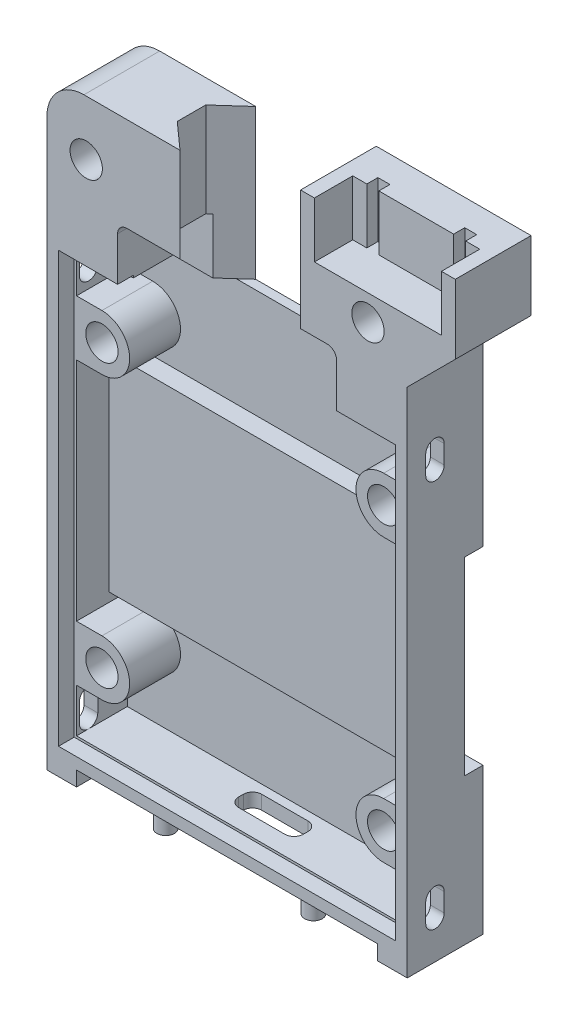
from build123d import *

# Parameters (mm, degrees)
SKETCH1_R              = 1.75
BASE_SHAPE_DEPTH       = 8.2
SKETCH3_W              = 2
SKETCH3_H              = 20.5
STRAP_CUT_DEPTH        = 53.32064602
XT60_CUT_REACH         = 70.811
SKETCH5_R              = 1
POWER_WIRES_CUT_DEPTH  = 53.32064602
SKETCH6_W              = 23.7
SKETCH6_H              = 5
IO_WIRES_CUT_DEPTH     = 6
BOTTOM_DEPTH           = 36
BOTTOM_START           = -1
BOTTOM_HOLES_OUTLINE_R = 1.75
BOTTOM_HOLES_DEPTH     = 1
SKETCH8_W              = 36.5
SKETCH8_H              = 46.5
PCB_CUT_DEPTH          = 1.7
LEDBAR_WIRES_CUT_REACH = 73.411
SKETCH13_W             = 3.2
SKETCH13_H             = 8.2
LEDBAR_SIDES_DEPTH     = 1.6
SKETCH14_R             = 0.95
LEDBAR_MOUNTS_DEPTH    = 2
SKETCH16_W             = 13.75
SKETCH16_H             = 4.15
SKETCH16_W_2           = 1.3
SKETCH16_H_2           = 1.2
BALANCE_PLUG_CUT_DEPTH = 6


with BuildPart() as part:
    # Sketch1 → Base shape (new body)
    with BuildSketch(Plane.XY):
        with BuildLine():
            ThreePointArc((-15.5, 31.1), (-18.328427125, 29.928427125), (-19.5, 27.1))
            Line((-19.5, 27.1), (-19.5, -32.6))
            Line((-19.5, -32.6), (19.5, -32.6))
            Line((19.5, -32.6), (19.5, 21.2))
            Line((19.5, 21.2), (24.7, 26.4))
            Line((24.7, 26.4), (24.7, 33.9))
            Line((24.7, 33.9), (7.95, 33.9))
            Line((7.95, 33.9), (7.95, 31.1))
            Line((7.95, 31.1), (-15.5, 31.1))
        make_face()
        with Locations((-15.25, -23.35)):
            Circle(SKETCH1_R, mode=Mode.SUBTRACT)
        with Locations((15.25, -23.35)):
            Circle(SKETCH1_R, mode=Mode.SUBTRACT)
        with BuildLine():
            Line((-18, -20.35), (-18, 4.15))
            Line((-18, 4.15), (-15.25, 4.15))
            ThreePointArc((-15.25, 4.15), (-12.25, 7.15), (-15.25, 10.15))
            Line((-15.25, 10.15), (-18, 10.15))
            Line((-18, 10.15), (-18, 14.9))
            Line((-18, 14.9), (18, 14.9))
            Line((18, 14.9), (18, 10.15))
            Line((18, 10.15), (15.25, 10.15))
            ThreePointArc((15.25, 10.15), (12.25, 7.15), (15.25, 4.15))
            Line((15.25, 4.15), (18, 4.15))
            Line((18, 4.15), (18, -20.35))
            Line((18, -20.35), (15.25, -20.35))
            ThreePointArc((15.25, -20.35), (12.25, -23.35), (15.25, -26.35))
            Line((15.25, -26.35), (18, -26.35))
            Line((18, -26.35), (18, -31.1))
            Line((18, -31.1), (-18, -31.1))
            Line((-18, -31.1), (-18, -26.35))
            Line((-18, -26.35), (-15.25, -26.35))
            ThreePointArc((-15.25, -26.35), (-12.25, -23.35), (-15.25, -20.35))
            Line((-15.25, -20.35), (-18, -20.35))
        make_face(mode=Mode.SUBTRACT)
        with Locations((-15.25, 7.15)):
            Circle(SKETCH1_R, mode=Mode.SUBTRACT)
        with Locations((-15.25, 25.15)):
            Circle(SKETCH1_R, mode=Mode.SUBTRACT)
        with Locations((15.25, 7.15)):
            Circle(SKETCH1_R, mode=Mode.SUBTRACT)
        with Locations((15.25, 25.15)):
            Circle(SKETCH1_R, mode=Mode.SUBTRACT)
    extrude(amount=BASE_SHAPE_DEPTH)

    # Sketch3 → Strap cut (cut, through all)
    with BuildSketch(Plane(origin=(19.5, 0, 0), x_dir=(0, 0, -1), z_dir=(1, 0, 0))):
        with Locations((-1, -8.1)):
            Rectangle(SKETCH3_W, SKETCH3_H)
    extrude(amount=-STRAP_CUT_DEPTH, mode=Mode.SUBTRACT)

    # Sketch4 → XT60 cut (cut, up to next)
    with BuildSketch(Plane(origin=(0, 31.1, 0), x_dir=(1, 0, 0), z_dir=(0, 1, 0)), mode=Mode.PRIVATE) as xt60_cut_sk1:
        Polygon((7.95, -8.2), (7.95, 0), (-5.099802631, 0), (-7.95, -2.555349365), (-7.95, -5.644650635), (-5.099802631, -8.2), align=None)
    xt60_cut_tool1 = extrude(xt60_cut_sk1.sketch, amount=-XT60_CUT_REACH, mode=Mode.PRIVATE) & part.part
    add(xt60_cut_tool1.solids().sort_by_distance((0.414164, 31.1, 4.1))[0], mode=Mode.SUBTRACT)

    # Sketch5 → Power wires cut (cut, through all)
    with BuildSketch(Plane(origin=(19.5, 0, 0), x_dir=(0, 0, -1), z_dir=(1, 0, 0))):
        with Locations((-5.2, 13.9)):
            Circle(SKETCH5_R)
        with Locations((-5.2, 11.9)):
            Circle(SKETCH5_R)
        with BuildLine():
            ThreePointArc((-5.2, 12.9), (-5.907106781, 13.192893219), (-6.2, 13.9))
            Line((-6.2, 13.9), (-6.2, 11.9))
            ThreePointArc((-6.2, 11.9), (-5.907106781, 12.607106781), (-5.2, 12.9))
        make_face()
        with BuildLine():
            Line((-4.2, 11.9), (-4.2, 13.9))
            ThreePointArc((-4.2, 13.9), (-4.492893219, 13.192893219), (-5.2, 12.9))
            ThreePointArc((-5.2, 12.9), (-4.492893219, 12.607106781), (-4.2, 11.9))
        make_face()
        with Locations((-5.2, -30.1)):
            Circle(SKETCH5_R)
        with Locations((-5.2, -28.1)):
            Circle(SKETCH5_R)
        with BuildLine():
            ThreePointArc((-5.2, -29.1), (-4.492893219, -29.392893219), (-4.2, -30.1))
            Line((-4.2, -30.1), (-4.2, -28.1))
            ThreePointArc((-4.2, -28.1), (-4.492893219, -28.807106781), (-5.2, -29.1))
        make_face()
        with BuildLine():
            Line((-6.2, -28.1), (-6.2, -30.1))
            ThreePointArc((-6.2, -30.1), (-5.907106781, -29.392893219), (-5.2, -29.1))
            ThreePointArc((-5.2, -29.1), (-5.907106781, -28.807106781), (-6.2, -28.1))
        make_face()
    extrude(amount=-POWER_WIRES_CUT_DEPTH, mode=Mode.SUBTRACT)

    # Sketch6 → IO wires cut (cut)
    with BuildSketch(Plane.XY.offset(8.2)):
        with BuildLine():
            ThreePointArc((-10.85, 20.9), (-11.557106781, 20.607106781), (-11.85, 19.9))
            Line((-11.85, 19.9), (11.85, 19.9))
            ThreePointArc((11.85, 19.9), (11.557106781, 20.607106781), (10.85, 20.9))
            Line((10.85, 20.9), (-10.85, 20.9))
        make_face()
        with Locations((0, 17.4)):
            Rectangle(SKETCH6_W, SKETCH6_H)
    extrude(amount=-IO_WIRES_CUT_DEPTH, mode=Mode.SUBTRACT)

    # Bottom: read off the stored shape, not the designer's step
    # Bottom outline → Bottom (add)
    with BuildSketch(Plane(origin=(-18, 0, 0), x_dir=(0, 0, -1), z_dir=(1, 0, 0))):
        Polygon((0, -18.35), (-2, -18.35), (-2, 2.15), (0, 2.15), (0, 14.9), (-1, 14.9), (-1, 3.15), (-3, 3.15), (-3, -19.35), (-1, -19.35), (-1, -31.1), (0, -31.1), align=None)
    extrude(amount=BOTTOM_DEPTH)

    # Bottom holes: read off the stored shape, not the designer's step
    # Bottom holes outline → Bottom holes (cut)
    with BuildSketch(Plane(origin=(0, 0, 0), x_dir=(-1, 0, 0), z_dir=(0, 0, -1)).offset(BOTTOM_START)):
        with Locations((-15.25, -23.35)):
            Circle(BOTTOM_HOLES_OUTLINE_R)
        with Locations((15.25, -23.35)):
            Circle(BOTTOM_HOLES_OUTLINE_R)
        with Locations((15.25, 7.15)):
            Circle(BOTTOM_HOLES_OUTLINE_R)
        with Locations((-15.25, 7.15)):
            Circle(BOTTOM_HOLES_OUTLINE_R)
    extrude(amount=BOTTOM_HOLES_DEPTH, mode=Mode.SUBTRACT)

    # Sketch8 → PCB cut (cut)
    with BuildSketch(Plane.XY.offset(8.2)):
        with Locations((0, -8.1)):
            Rectangle(SKETCH8_W, SKETCH8_H)
    extrude(amount=-PCB_CUT_DEPTH, mode=Mode.SUBTRACT)

    # Sketch11 → Ledbar wires cut (cut, up to next)
    with BuildSketch(Plane.XZ.offset(32.6), mode=Mode.PRIVATE) as ledbar_wires_cut_sk1:
        with BuildLine():
            Line((-2.5, 4.45), (2.5, 4.45))
            ThreePointArc((2.5, 4.45), (3.207106781, 4.157106781), (3.5, 3.45))
            Line((3.5, 3.45), (3.5, 2.95))
            ThreePointArc((3.5, 2.95), (3.207106781, 2.242893219), (2.5, 1.95))
            Line((2.5, 1.95), (-2.5, 1.95))
            ThreePointArc((-2.5, 1.95), (-3.207106781, 2.242893219), (-3.5, 2.95))
            Line((-3.5, 2.95), (-3.5, 3.45))
            ThreePointArc((-3.5, 3.45), (-3.207106781, 4.157106781), (-2.5, 4.45))
        make_face()
    ledbar_wires_cut_tool1 = extrude(ledbar_wires_cut_sk1.sketch, amount=-LEDBAR_WIRES_CUT_REACH, mode=Mode.PRIVATE) & part.part
    add(ledbar_wires_cut_tool1.solids().sort_by_distance((0, -32.6, 3.2))[0], mode=Mode.SUBTRACT)

    # Sketch13 → Ledbar sides (add)
    with BuildSketch(Plane.XZ.offset(32.6)):
        with Locations((17.9, 4.1)):
            Rectangle(SKETCH13_W, SKETCH13_H)
        with Locations((-17.9, 4.1)):
            Rectangle(SKETCH13_W, SKETCH13_H)
    extrude(amount=LEDBAR_SIDES_DEPTH)

    # Sketch14 → Ledbar mounts (add)
    with BuildSketch(Plane.XZ.offset(32.6)):
        with Locations(Location((8, 6.85, 0), (0, 0, 180))):
            Circle(SKETCH14_R)
        with Locations(Location((-8, 6.85, 0), (0, 0, 180))):
            Circle(SKETCH14_R)
    extrude(amount=LEDBAR_MOUNTS_DEPTH)

    # Sketch16 → Balance plug cut (cut)
    with BuildSketch(Plane(origin=(0, 33.9, 0), x_dir=(1, 0, 0), z_dir=(0, 1, 0))):
        with Locations((16.325, -6.125)):
            Rectangle(SKETCH16_W, SKETCH16_H)
        with Locations((11.625, -3.45)):
            Rectangle(SKETCH16_W_2, SKETCH16_H_2)
        with Locations((21.025, -3.45)):
            Rectangle(SKETCH16_W_2, SKETCH16_H_2)
    extrude(amount=-BALANCE_PLUG_CUT_DEPTH, mode=Mode.SUBTRACT)


solid = part.part
